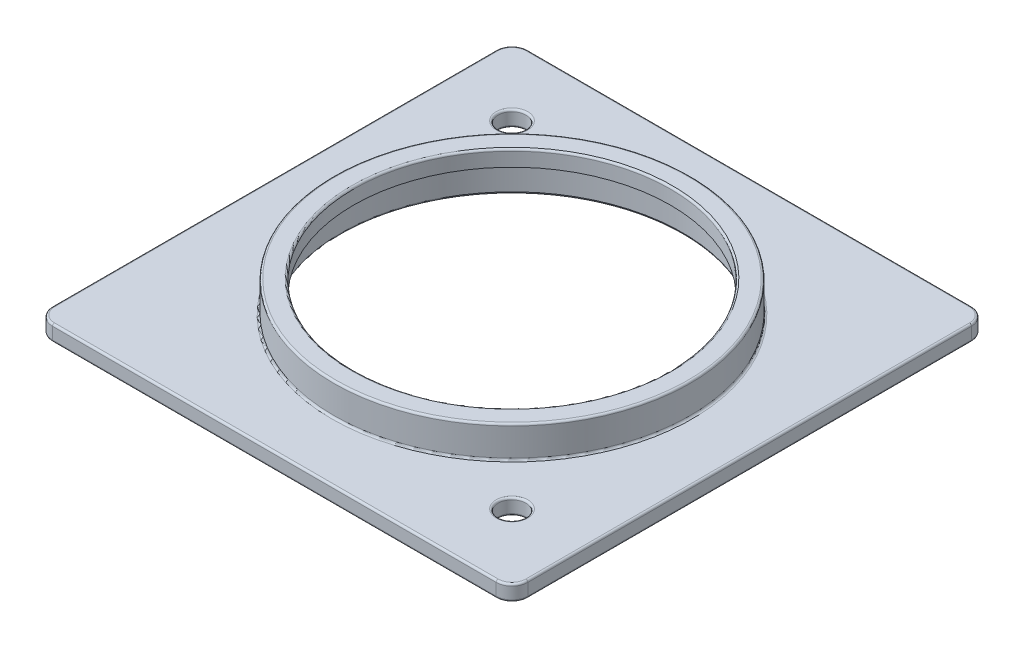
from build123d import *

# Parameters (mm, degrees)
SKETCH1_W           = 60
SKETCH1_H           = 60
SKETCH1_R           = 22.5
SKETCH1_R_2         = 1.75
BOSS_EXTRUDE1_DEPTH = 2
SKETCH1_2_R         = 22.5
SKETCH1_2_R_2       = 20
BOSS_EXTRUDE2_DEPTH = 6
SKETCH1_4_R         = 21.5
CUT_EXTRUDE1_DEPTH  = 4
FILLET1_R           = 0.25
FILLET2_R           = 2


with BuildPart() as part:
    # Sketch1 → Boss-Extrude1 (new body)
    with BuildSketch(Plane(origin=(0, 0, 0), x_dir=(1, 0, 0), z_dir=(0, 1, 0))):
        Rectangle(SKETCH1_W, SKETCH1_H)
        with Locations(Location((0, 0, 0), (0, 0, 270))):
            Circle(SKETCH1_R, mode=Mode.SUBTRACT)
        with Locations(Location((21.213203436, -21.213203436, 0), (0, 0, 270))):
            Circle(SKETCH1_R_2, mode=Mode.SUBTRACT)
        with Locations(Location((-21.213203436, 21.213203436, 0), (0, 0, 270))):
            Circle(SKETCH1_R_2, mode=Mode.SUBTRACT)
    extrude(amount=BOSS_EXTRUDE1_DEPTH)

    # Sketch1<2> → Boss-Extrude2 (add)
    with BuildSketch(Plane(origin=(0, 0, 0), x_dir=(1, 0, 0), z_dir=(0, 1, 0))):
        with Locations(Location((0, 0, 0), (0, 0, 270))):
            Circle(SKETCH1_2_R)
        with Locations(Location((0, 0, 0), (0, 0, 270))):
            Circle(SKETCH1_2_R_2, mode=Mode.SUBTRACT)
    extrude(amount=BOSS_EXTRUDE2_DEPTH)

    # Sketch1<4> → Cut-Extrude1 (cut)
    with BuildSketch(Plane(origin=(0, 0, 0), x_dir=(1, 0, 0), z_dir=(0, 1, 0))):
        with Locations(Location((0, 0, 0), (0, 0, 270))):
            Circle(SKETCH1_4_R)
    extrude(amount=CUT_EXTRUDE1_DEPTH, mode=Mode.SUBTRACT)

    # Fillet1
    fillet1_edges = [part.edges().sort_by_distance(p)[0] for p in [
        (30, 0, 0),
        (0, 0, 30),
        (-21.213203436, 0, -22.963203436),
        (21.213203436, 0, 19.463203436),
        (21.213203436, 2, 19.463203436),
        (-21.213203436, 2, -22.963203436),
        (0, 2, 30),
        (0, 6, -20),
        (0, 6, -22.5),
        (30, 2, 0),
        (0, 0, -21.5),
        (0, 2, -30),
        (-30, 2, 0),
        (0, 2, -22.5),
        (-30, 0, 0),
        (0, 0, -30),
    ]]
    fillet(fillet1_edges, radius=FILLET1_R)

    # Fillet2
    # the kernel refuses this fillet: 2 mm, written as the material it takes off along each edge
    with BuildSketch(Plane(origin=(-28, 0, 28), x_dir=(0, 0, 1), z_dir=(1, 0, 0))) as fillet2_piece_1:
        with BuildLine():
            CenterArc((1.75, -0.25), 0.25, 0, 90)
            Line((2, -0.25), (2, 0))
            Line((2, 0), (1.75, 0))
        make_face()
    revolve(axis=Axis((-28, 0, 28), (0, -1, 0)), revolution_arc=90, mode=Mode.SUBTRACT)
    with BuildSketch(Plane(origin=(-28, 0, -28), x_dir=(-1, 0, 0), z_dir=(0, 0, 1))) as fillet2_piece_2:
        with BuildLine():
            CenterArc((1.75, -0.25), 0.25, 0, 90)
            Line((2, -0.25), (2, 0))
            Line((2, 0), (1.75, 0))
        make_face()
    revolve(axis=Axis((-28, 0, -28), (0, -1, 0)), revolution_arc=90, mode=Mode.SUBTRACT)
    with BuildSketch(Plane(origin=(28, 0, 28), x_dir=(1, 0, 0), z_dir=(0, 0, -1))) as fillet2_piece_3:
        with BuildLine():
            CenterArc((1.75, -0.25), 0.25, 0, 90)
            Line((2, -0.25), (2, 0))
            Line((2, 0), (1.75, 0))
        make_face()
    revolve(axis=Axis((28, 0, 28), (0, -1, 0)), revolution_arc=90, mode=Mode.SUBTRACT)
    with BuildSketch(Plane(origin=(28, 0, -28), x_dir=(0, 0, -1), z_dir=(-1, 0, 0))) as fillet2_piece_4:
        with BuildLine():
            CenterArc((1.75, -0.25), 0.25, 0, 90)
            Line((2, -0.25), (2, 0))
            Line((2, 0), (1.75, 0))
        make_face()
    revolve(axis=Axis((28, 0, -28), (0, -1, 0)), revolution_arc=90, mode=Mode.SUBTRACT)
    with BuildSketch(Plane(origin=(28, 2, 28), x_dir=(0, 0, 1), z_dir=(-1, 0, 0))) as fillet2_piece_5:
        with BuildLine():
            CenterArc((1.75, -0.25), 0.25, 0, 90)
            Line((2, -0.25), (2, 0))
            Line((2, 0), (1.75, 0))
        make_face()
    revolve(axis=Axis((28, 2, 28), (0, 1, 0)), revolution_arc=90, mode=Mode.SUBTRACT)
    with BuildSketch(Plane(origin=(28, 2, -28), x_dir=(1, 0, 0), z_dir=(0, 0, 1))) as fillet2_piece_6:
        with BuildLine():
            CenterArc((1.75, -0.25), 0.25, 0, 90)
            Line((2, -0.25), (2, 0))
            Line((2, 0), (1.75, 0))
        make_face()
    revolve(axis=Axis((28, 2, -28), (0, 1, 0)), revolution_arc=90, mode=Mode.SUBTRACT)
    with BuildSketch(Plane(origin=(-28, 2, 28), x_dir=(-1, 0, 0), z_dir=(0, 0, -1))) as fillet2_piece_7:
        with BuildLine():
            CenterArc((1.75, -0.25), 0.25, 0, 90)
            Line((2, -0.25), (2, 0))
            Line((2, 0), (1.75, 0))
        make_face()
    revolve(axis=Axis((-28, 2, 28), (0, 1, 0)), revolution_arc=90, mode=Mode.SUBTRACT)
    with BuildSketch(Plane(origin=(-28, 2, -28), x_dir=(0, 0, -1), z_dir=(1, 0, 0))) as fillet2_piece_8:
        with BuildLine():
            CenterArc((1.75, -0.25), 0.25, 0, 90)
            Line((2, -0.25), (2, 0))
            Line((2, 0), (1.75, 0))
        make_face()
    revolve(axis=Axis((-28, 2, -28), (0, 1, 0)), revolution_arc=90, mode=Mode.SUBTRACT)
    with BuildSketch(Plane(origin=(30, 0, -30), x_dir=(0, 0, 1), z_dir=(0, 1, 0)), Plane(origin=(30, 0, 30), x_dir=(-1, 0, 0), z_dir=(0, 1, 0))) as fillet2_piece_9:
        with BuildLine():
            CenterArc((FILLET2_R, -FILLET2_R), FILLET2_R, 90, 90)
            Line((0, -FILLET2_R), (0, 0))
            Line((0, 0), (FILLET2_R, 0))
        make_face()
    extrude(amount=2, mode=Mode.SUBTRACT)
    with BuildSketch(Plane(origin=(-30, 0, -30), x_dir=(0, 0, 1), z_dir=(0, 1, 0)), Plane(origin=(-30, 0, 30), x_dir=(1, 0, 0), z_dir=(0, 1, 0))) as fillet2_piece_10:
        with BuildLine():
            CenterArc((FILLET2_R, FILLET2_R), FILLET2_R, 180, 90)
            Line((0, FILLET2_R), (0, 0))
            Line((0, 0), (FILLET2_R, 0))
        make_face()
    extrude(amount=2, mode=Mode.SUBTRACT)


solid = part.part
